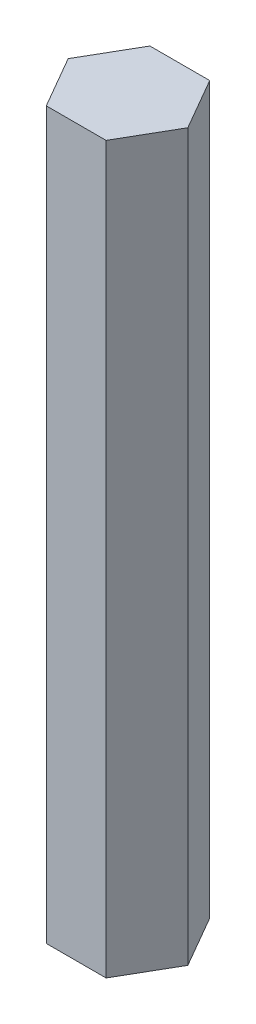
from build123d import *

# Parameters (mm, degrees)
BOSS_EXTRUDE1_DEPTH = 44.45


with BuildPart() as part:
    # Sketch1 → Boss-Extrude1 (new, symmetric)
    with BuildSketch(Plane(origin=(0, 0, 0), x_dir=(1, 0, 0), z_dir=(0, 1, 0))):
        Polygon((7.332348419, 0), (3.666174209, 6.35), (-3.666174209, 6.35), (-7.332348419, 0), (-3.666174209, -6.35), (3.666174209, -6.35), align=None)
    extrude(amount=BOSS_EXTRUDE1_DEPTH, both=True)


solid = part.part
